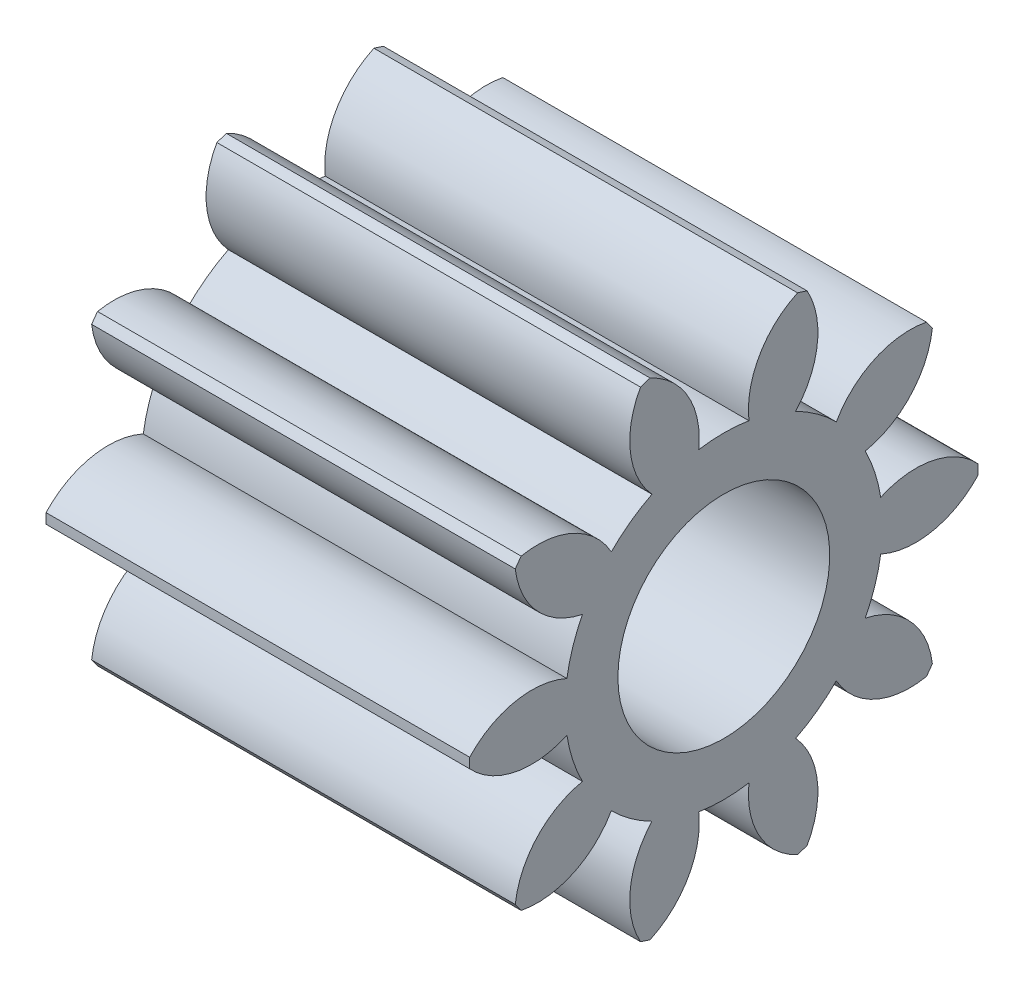
from build123d import *

# Parameters (mm, degrees)
BASPROSKE_W     = 10
BASPROSKE_H     = 6
TOOTHCUT_DEPTH  = 14.114877049
TEETHCUTS_COUNT = 10
TEETHCUTS_ANGLE = 324
BORSKE_R        = 2.5
BORE_DEPTH      = 50.0000508


with BuildPart() as part:
    # BasProSke → Base-Revolve (revolve)
    with BuildSketch(Plane(origin=(0, 0, 0), x_dir=(1, 0, 0), z_dir=(0, 1, 0))):
        with Locations((5, 3)):
            Rectangle(BASPROSKE_W, BASPROSKE_H)
    revolve(axis=Axis((-10, 0, 0), (1, 0, 0)))

    # TooCutSke → ToothCut (cut, through all)
    with BuildSketch(Plane(origin=(0, 0, 0), x_dir=(0, 0, -1), z_dir=(1, 0, 0))):
        with BuildLine():
            ThreePointArc((0.59278292, 3.701838653), (0, 3.749), (-0.59278292, 3.701838653))
            ThreePointArc((-0.59278292, 3.701838653), (-0.846593509, 4.924114224), (-1.775771316, 5.757784417))
            ThreePointArc((-1.775771316, 5.757784417), (0, 6.0254), (1.775771316, 5.757784417))
            ThreePointArc((1.775771316, 5.757784417), (0.846593509, 4.924114224), (0.59278292, 3.701838653))
        make_face()
    toothcut = extrude(amount=TOOTHCUT_DEPTH, mode=Mode.SUBTRACT)

    # TeethCuts: ToothCut ×10 about axis
    teethcuts_axis = Axis((-10, 0, 0), (1, 0, 0))
    for i in range(1, TEETHCUTS_COUNT):
        add(toothcut.rotate(teethcuts_axis, i * TEETHCUTS_ANGLE / (TEETHCUTS_COUNT - 1)), mode=Mode.SUBTRACT)

    # BorSke → Bore (cut, symmetric)
    with BuildSketch(Plane(origin=(0, 0, 0), x_dir=(0, 0, -1), z_dir=(1, 0, 0))):
        Circle(BORSKE_R)
    extrude(amount=BORE_DEPTH, both=True, mode=Mode.SUBTRACT)


solid = part.part
